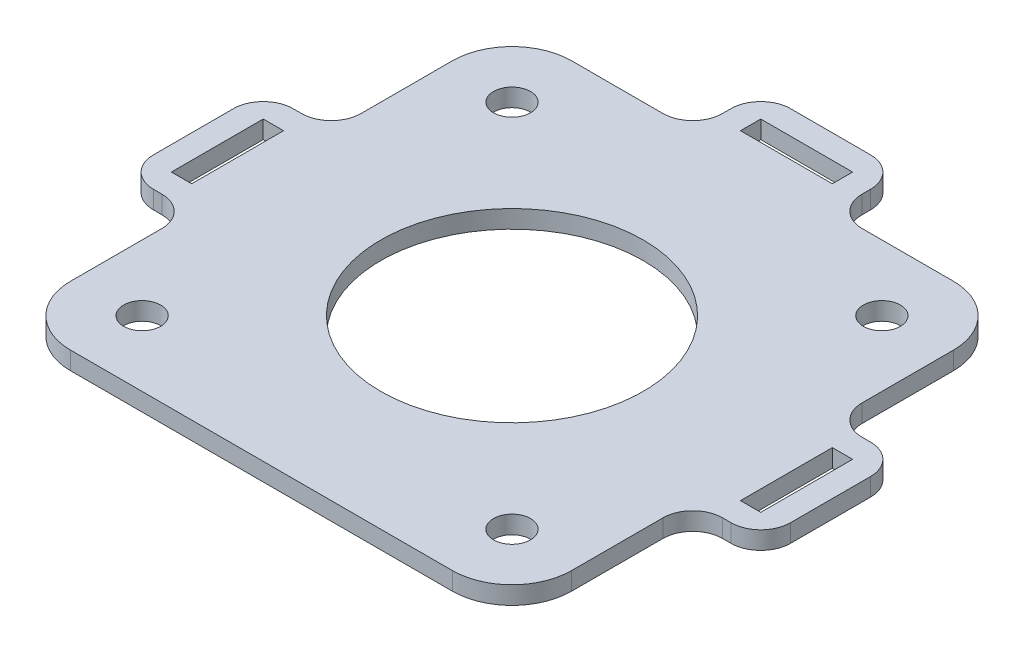
from build123d import *

# Parameters (mm, degrees)
SKETCH1_R           = 1.55
SKETCH1_R_2         = 11
SKETCH1_W           = 1.7
SKETCH1_H           = 7.7
SKETCH1_W_2         = 7.7
SKETCH1_H_2         = 1.7
BOSS_EXTRUDE1_DEPTH = 1.5
FILLET2_R           = 5
FILLET1_R           = 2.5


with BuildPart() as part:
    # Sketch1 → Boss-Extrude1 (new body)
    with BuildSketch(Plane(origin=(0, 0, 0), x_dir=(1, 0, 0), z_dir=(0, 1, 0))):
        Polygon((21, 5.85), (26.7, 5.85), (26.7, -5.85), (21, -5.85), (21, -21), (5.85, -21), (-5.85, -21), (-21, -21), (-21, -5.85), (-26.7, -5.85), (-26.7, 5.85), (-21, 5.85), (-21, 21), (-5.85, 21), (-5.85, 26.7), (5.85, 26.7), (5.85, 21), (21, 21), align=None)
        with Locations((-15.5, 15.5)):
            Circle(SKETCH1_R, mode=Mode.SUBTRACT)
        with Locations((15.5, 15.5)):
            Circle(SKETCH1_R, mode=Mode.SUBTRACT)
        with Locations((15.5, -15.5)):
            Circle(SKETCH1_R, mode=Mode.SUBTRACT)
        with Locations((-15.5, -15.5)):
            Circle(SKETCH1_R, mode=Mode.SUBTRACT)
        Circle(SKETCH1_R_2, mode=Mode.SUBTRACT)
        with Locations((23.85, 0)):
            Rectangle(SKETCH1_W, SKETCH1_H, mode=Mode.SUBTRACT)
        with Locations((-23.85, 0)):
            Rectangle(SKETCH1_W, SKETCH1_H, mode=Mode.SUBTRACT)
        with Locations((0, 23.85)):
            Rectangle(SKETCH1_W_2, SKETCH1_H_2, mode=Mode.SUBTRACT)
    extrude(amount=BOSS_EXTRUDE1_DEPTH)

    # Fillet2
    fillet2_edges = [part.edges().sort_by_distance(p)[0] for p in [
        (21, 0.75, 21),
        (-21, 0.75, 21),
        (-21, 0.75, -21),
        (21, 0.75, -21),
    ]]
    fillet(fillet2_edges, radius=FILLET2_R)

    # Fillet1
    fillet1_edges = [part.edges().sort_by_distance(p)[0] for p in [
        (-21, 0.75, -5.85),
        (-26.7, 0.75, -5.85),
        (-21, 0.75, 5.85),
        (-26.7, 0.75, 5.85),
        (5.85, 0.75, -21),
        (5.85, 0.75, -26.7),
        (-5.85, 0.75, -26.7),
        (-5.85, 0.75, -21),
        (21, 0.75, 5.85),
        (26.7, 0.75, 5.85),
        (26.7, 0.75, -5.85),
        (21, 0.75, -5.85),
    ]]
    fillet(fillet1_edges, radius=FILLET1_R)


solid = part.part
